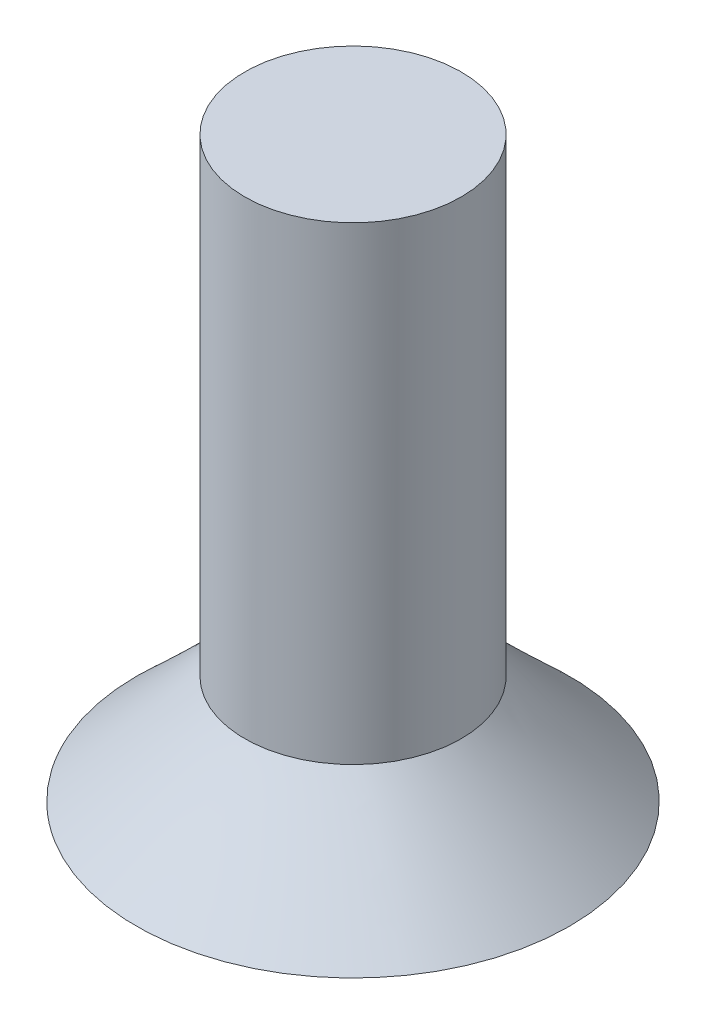
from build123d import *

# Parameters (mm, degrees)
SKETCH9_R           = 1.5
BOSS_EXTRUDE1_DEPTH = 6.5
CUT_EXTRUDE1_DEPTH  = 1


with BuildPart() as part:
    # Loft1: read off the stored shape, not the designer's step
    # Loft1: loft between two sections, ruled curve by curve
    loft1_from = [
        Edge.make_bspline([(2.279993266, 0, -1.949777092), (-1.619560918, 0, -6.509763623), (-6.179547449, 0, -2.61020944), (-2.279993266, 0, 1.949777092), (1.619560918, 0, 6.509763623), (6.179547449, 0, 2.61020944), (2.279993266, 0, -1.949777092)], [0, 0, 0, 0, 0.5, 0.5, 0.5, 1, 1, 1, 1], 3, [1, 0.333333333, 0.333333333, 1, 0.333333333, 0.333333333, 1]),
    ]
    loft1_to = [
        Edge.make_bspline([(0.694387174, 1.5, -1.32959635), (-1.964805526, 1.5, -2.718370697), (-3.353579873, 1.5, -0.059177997), (-0.694387174, 1.5, 1.32959635), (1.964805526, 1.5, 2.718370697), (3.353579873, 1.5, 0.059177997), (0.694387174, 1.5, -1.32959635)], [0, 0, 0, 0, 0.5, 0.5, 0.5, 1, 1, 1, 1], 3, [1, 0.333333333, 0.333333333, 1, 0.333333333, 0.333333333, 1]),
    ]
    loft1 = Solid(Shell([*[Face.make_surface_from_curves(loft1_from[k], loft1_to[k]) for k in range(1)], Face(Wire(loft1_from)), Face(Wire(loft1_to))]))
    add(loft1)

    # Sketch9 → Boss-Extrude1 (add)
    with BuildSketch(Plane(origin=(0, 1.5, 0), x_dir=(1, 0, 0), z_dir=(0, 1, 0))):
        with Locations(Location((0, 0, 0), (0, 0, 62.424))):
            Circle(SKETCH9_R)
    extrude(amount=BOSS_EXTRUDE1_DEPTH)

    # Sketch10 → Cut-Extrude1 (cut)
    with BuildSketch(Plane(origin=(0, 0, 0), x_dir=(-1, 0, 0), z_dir=(0, -1, 0))):
        Polygon((-1.443375673, 0), (-0.721687836, -1.25), (0.721687836, -1.25), (1.443375673, 0), (0.721687836, 1.25), (-0.721687836, 1.25), align=None)
    extrude(amount=-CUT_EXTRUDE1_DEPTH, mode=Mode.SUBTRACT)


solid = part.part
